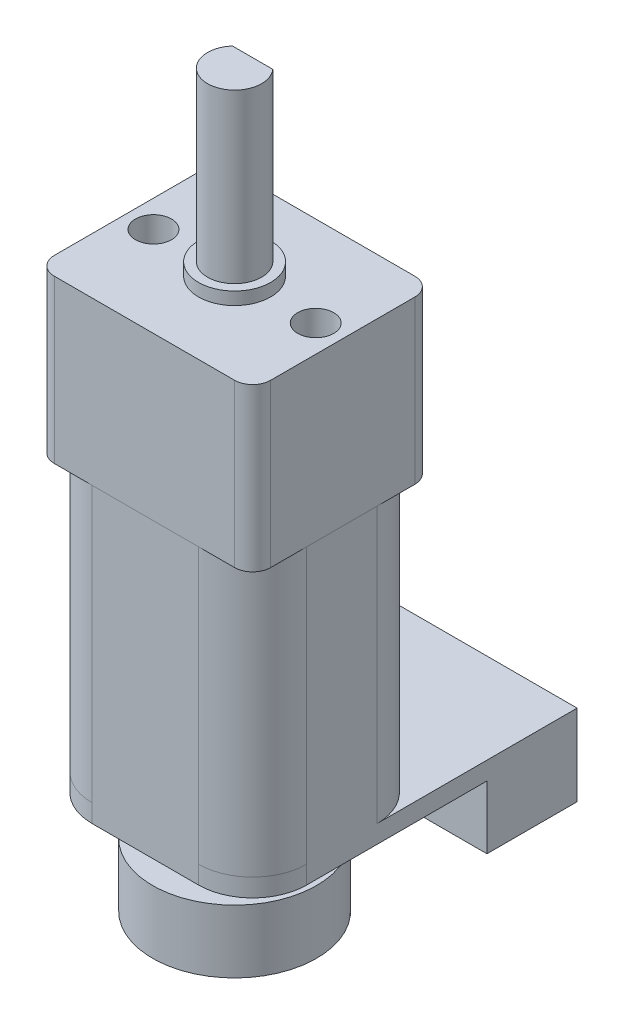
from build123d import *

# Parameters (mm, degrees)
SKETCH_1_W          = 12
SKETCH_1_H          = 10
EXTRUDE_1_DEPTH     = 9
SKETCH_2_R          = 1
CUT_EXTRUDE_1_DEPTH = 12.916375288
SKETCH_3_R          = 2
EXTRUDE_2_DEPTH     = 0.7
SKETCH_4_R          = 1.5
EXTRUDE_3_DEPTH     = 9.3
SKETCH_5_OUTSIDE_W  = 18.92
SKETCH_5_OUTSIDE_H  = 16.92
CUT_EXTRUDE_2_DEPTH = 9.3
FILLET_1_R          = 1
SKETCH_6_W          = 11.9
SKETCH_6_H          = 9.9
EXTRUDE_4_DEPTH     = 15.3
FILLET_3_R          = 3
SKETCH_7_W          = 11.9
SKETCH_7_H          = 18
EXTRUDE_5_DEPTH     = 1
FILLET_4_R          = 3
SKETCH_8_R          = 0.5
EXTRUDE_6_DEPTH     = 5.2
SKETCH_9_R          = 4.55
EXTRUDE_7_DEPTH     = 3.5
SKETCH_10_W         = 11.9
SKETCH_10_H         = 5
EXTRUDE_8_DEPTH     = 3.5
SKETCH_11_W         = 11
SKETCH_11_H         = 4
CUT_EXTRUDE_3_DEPTH = 3


with BuildPart() as part:
    # 草图1 → 凸台-拉伸1 (new body)
    with BuildSketch(Plane(origin=(0, 0, 0), x_dir=(1, 0, 0), z_dir=(0, 1, 0))):
        Rectangle(SKETCH_1_W, SKETCH_1_H)
    extrude(amount=EXTRUDE_1_DEPTH)

    # 草图2 → 切除-拉伸1 (cut, through all)
    with BuildSketch(Plane(origin=(0, 9, 0), x_dir=(1, 0, 0), z_dir=(0, 1, 0))):
        with Locations(Location((-4.5, 0, 0), (0, 0, 270))):
            Circle(SKETCH_2_R)
        with Locations(Location((4.5, 0, 0), (0, 0, 90))):
            Circle(SKETCH_2_R)
    extrude(amount=-CUT_EXTRUDE_1_DEPTH, mode=Mode.SUBTRACT)

    # 草图3 → 凸台-拉伸2 (add)
    with BuildSketch(Plane(origin=(0, 9, 0), x_dir=(1, 0, 0), z_dir=(0, 1, 0))):
        with Locations(Location((0, 0, 0), (0, 0, 270))):
            Circle(SKETCH_3_R)
    extrude(amount=EXTRUDE_2_DEPTH)

    # 草图4 → 凸台-拉伸3 (add)
    with BuildSketch(Plane(origin=(0, 9.7, 0), x_dir=(1, 0, 0), z_dir=(0, 1, 0))):
        with Locations(Location((0, 0, 0), (0, 0, 270))):
            Circle(SKETCH_4_R)
    extrude(amount=EXTRUDE_3_DEPTH)

    # 草图5 outside → 切除-拉伸2 (cut)
    with BuildSketch(Plane(origin=(0, 19, 0), x_dir=(1, 0, 0), z_dir=(0, 1, 0))):
        Rectangle(SKETCH_5_OUTSIDE_W, SKETCH_5_OUTSIDE_H)
        with BuildLine():
            Line((-1.118033989, 1), (1.118033989, 1))
            ThreePointArc((1.118033989, 1), (0, -1.5), (-1.118033989, 1))
        make_face(mode=Mode.SUBTRACT)
    extrude(amount=-CUT_EXTRUDE_2_DEPTH, mode=Mode.SUBTRACT)

    # 圆角1
    fillet_1_edges = [part.edges().sort_by_distance(p)[0] for p in [
        (-6, 4.5, -5),
        (6, 4.5, -5),
        (6, 4.5, 5),
        (-6, 4.5, 5),
    ]]
    fillet(fillet_1_edges, radius=FILLET_1_R)

    # 草图6 → 凸台-拉伸4 (add)
    with BuildSketch(Plane.XZ):
        Rectangle(SKETCH_6_W, SKETCH_6_H)
    extrude(amount=EXTRUDE_4_DEPTH)

    # 圆角3
    # the kernel refuses this fillet: 3 mm, written as the material it takes off along each edge
    with BuildSketch(Plane(origin=(-5.95, 0, 4.95), x_dir=(1, 0, 0), z_dir=(0, -1, 0)), Plane(origin=(-5.95, 0, -4.95), x_dir=(0, 0, 1), z_dir=(0, -1, 0))) as fillet_3_piece_1:
        with BuildLine():
            CenterArc((FILLET_3_R, -FILLET_3_R), FILLET_3_R, 90, 90)
            Line((0, -FILLET_3_R), (0, 0))
            Line((0, 0), (FILLET_3_R, 0))
        make_face()
    extrude(amount=22.8, mode=Mode.SUBTRACT)
    with BuildSketch(Plane(origin=(5.95, 0, -4.95), x_dir=(0, 0, 1), z_dir=(0, -1, 0)), Plane(origin=(5.95, 0, 4.95), x_dir=(-1, 0, 0), z_dir=(0, -1, 0))) as fillet_3_piece_2:
        with BuildLine():
            CenterArc((FILLET_3_R, FILLET_3_R), FILLET_3_R, 180, 90)
            Line((0, FILLET_3_R), (0, 0))
            Line((0, 0), (FILLET_3_R, 0))
        make_face()
    extrude(amount=22.8, mode=Mode.SUBTRACT)

    # 草图7 → 凸台-拉伸5 (add)
    with BuildSketch(Plane.XZ.offset(15.3)):
        with Locations((0, -4.05)):
            Rectangle(SKETCH_7_W, SKETCH_7_H)
    extrude(amount=EXTRUDE_5_DEPTH)

    # 圆角4
    fillet_4_edges = [part.edges().sort_by_distance(p)[0] for p in [
        (5.95, -15.8, 4.95),
        (-5.95, -15.8, 4.95),
    ]]
    fillet(fillet_4_edges, radius=FILLET_4_R)

    # 草图8 → 凸台-拉伸6 (add)
    with BuildSketch(Plane.XZ.offset(16.3)):
        with Locations(Location((0, 0, 0), (0, 0, 270))):
            Circle(SKETCH_8_R)
    extrude(amount=EXTRUDE_6_DEPTH)

    # 草图9 → 凸台-拉伸7 (add)
    with BuildSketch(Plane.XZ.offset(21.5)):
        with Locations(Location((0, 0, 0), (0, 0, 270))):
            Circle(SKETCH_9_R)
    extrude(amount=-EXTRUDE_7_DEPTH)

    # 草图10 → 凸台-拉伸8 (add)
    with BuildSketch(Plane.XZ.offset(16.3)):
        with Locations((0, -10.55)):
            Rectangle(SKETCH_10_W, SKETCH_10_H)
    extrude(amount=EXTRUDE_8_DEPTH)

    # 草图11 → 切除-拉伸3 (cut)
    with BuildSketch(Plane(origin=(0, 0, -13.05), x_dir=(-1, 0, 0), z_dir=(0, 0, -1))):
        with Locations((0, -17.55)):
            Rectangle(SKETCH_11_W, SKETCH_11_H)
    extrude(amount=-CUT_EXTRUDE_3_DEPTH, mode=Mode.SUBTRACT)


solid = part.part
